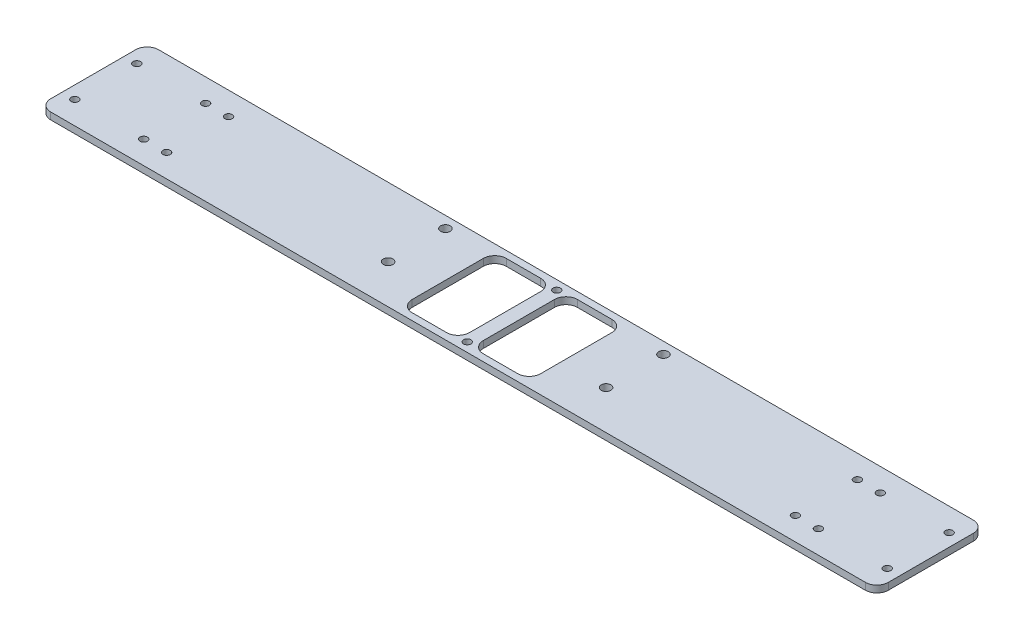
from build123d import *

# Parameters (mm, degrees)
SKETCH_1_W      = 365
SKETCH_1_H      = 47
SKETCH_1_R      = 2.1
SKETCH_1_R_2    = 1.6
SKETCH_1_W_2    = 25
SKETCH_1_H_2    = 41
EXTRUDE_1_DEPTH = 3
FILLET_1_R      = 5


with BuildPart() as part:
    # 草图1 → 凸台-拉伸1 (new body)
    with BuildSketch(Plane.XZ):
        with Locations((0, -23.5)):
            Rectangle(SKETCH_1_W, SKETCH_1_H)
        with Locations((-47.5, -17)):
            Circle(SKETCH_1_R, mode=Mode.SUBTRACT)
        with Locations((-47.5, -42)):
            Circle(SKETCH_1_R, mode=Mode.SUBTRACT)
        with Locations((-137, -10)):
            Circle(SKETCH_1_R_2, mode=Mode.SUBTRACT)
        with Locations((-177, -37)):
            Circle(SKETCH_1_R_2, mode=Mode.SUBTRACT)
        with Locations((-137, -37)):
            Circle(SKETCH_1_R_2, mode=Mode.SUBTRACT)
        with Locations((177, -10)):
            Circle(SKETCH_1_R_2, mode=Mode.SUBTRACT)
        with Locations((137, -37)):
            Circle(SKETCH_1_R_2, mode=Mode.SUBTRACT)
        with Locations((177, -37)):
            Circle(SKETCH_1_R_2, mode=Mode.SUBTRACT)
        with Locations((137, -10)):
            Circle(SKETCH_1_R_2, mode=Mode.SUBTRACT)
        with Locations((47.5, -42)):
            Circle(SKETCH_1_R, mode=Mode.SUBTRACT)
        with Locations((-177, -10)):
            Circle(SKETCH_1_R_2, mode=Mode.SUBTRACT)
        with Locations((47.5, -17)):
            Circle(SKETCH_1_R, mode=Mode.SUBTRACT)
        with Locations((0, -43)):
            Circle(SKETCH_1_R_2, mode=Mode.SUBTRACT)
        with Locations((0, -4)):
            Circle(SKETCH_1_R_2, mode=Mode.SUBTRACT)
        with Locations((-147, -10)):
            Circle(SKETCH_1_R_2, mode=Mode.SUBTRACT)
        with Locations((-147, -37)):
            Circle(SKETCH_1_R_2, mode=Mode.SUBTRACT)
        with Locations((147, -10)):
            Circle(SKETCH_1_R_2, mode=Mode.SUBTRACT)
        with Locations((147, -37)):
            Circle(SKETCH_1_R_2, mode=Mode.SUBTRACT)
        with Locations((15.5, -23.5)):
            Rectangle(SKETCH_1_W_2, SKETCH_1_H_2, mode=Mode.SUBTRACT)
        with Locations((-15.5, -23.5)):
            Rectangle(SKETCH_1_W_2, SKETCH_1_H_2, mode=Mode.SUBTRACT)
    extrude(amount=-EXTRUDE_1_DEPTH)

    # 圆角1
    fillet_1_edges = [part.edges().sort_by_distance(p)[0] for p in [
        (182.5, 1.5, -47),
        (182.5, 1.5, 0),
        (-182.5, 1.5, -47),
        (-182.5, 1.5, 0),
        (-3, 1.5, -3),
        (-28, 1.5, -3),
        (-3, 1.5, -44),
        (-28, 1.5, -44),
        (28, 1.5, -3),
        (3, 1.5, -3),
        (28, 1.5, -44),
        (3, 1.5, -44),
    ]]
    fillet(fillet_1_edges, radius=FILLET_1_R)


solid = part.part
